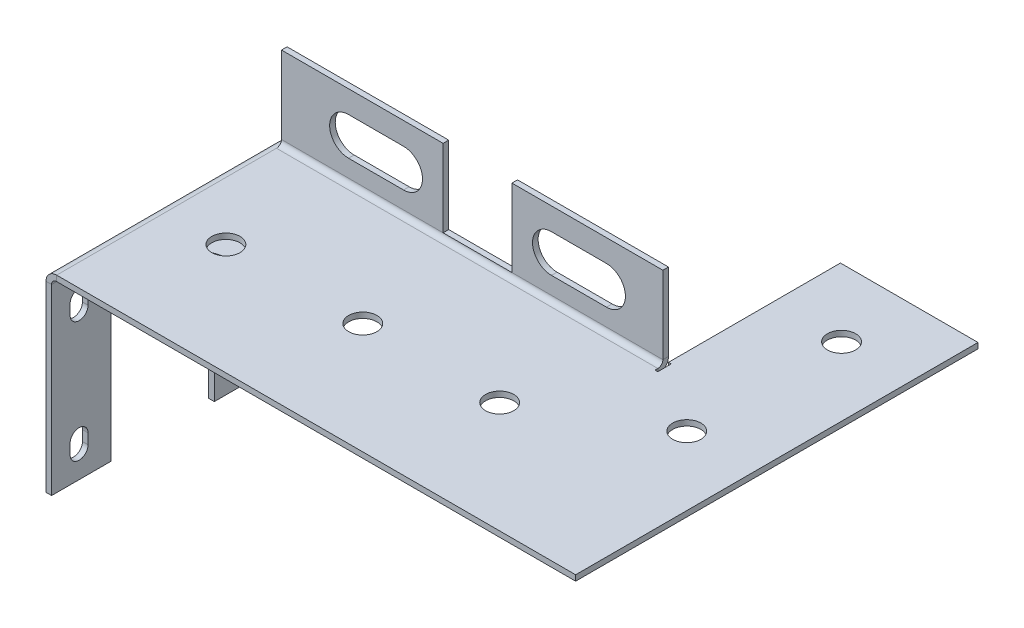
from build123d import *

# Parameters (mm, degrees)
BASE_FLANGE2_DEPTH           = 0.8128
EDGE_FLANGE1_STRIP_W         = 4.7244
EDGE_FLANGE1_STRIP_H         = 0.8128
EDGE_FLANGE1_STRIP_CUT_DEPTH = 33.5
EDGE_FLANGE1_DEPTH           = 33.5
EDGE_FLANGE1_FLAT_DEPTH      = 0.8128
EDGE_FLANGE3_START           = 0.7366
EDGE_FLANGE3_DEPTH           = 55.857
EDGE_FLANGE3_START_2         = 56.1872
EDGE_FLANGE3_2_DEPTH         = 0.4064
EDGE_FLANGE3_3_DEPTH         = 55.4506
CUT_EXTRUDE1_REACH           = 93.316
SKETCH21_R                   = 2.05
CUT_EXTRUDE2_REACH           = 88.903
SKETCH22_W                   = 10
SKETCH22_H                   = 11.2634
EDGE_FLANGE4_START           = -7.3164
EDGE_FLANGE4_DEPTH           = 15.8128
EDGE_FLANGE4_2_DEPTH         = 0.4064
EDGE_FLANGE4_START_2         = 8.09
EDGE_FLANGE4_3_DEPTH         = 0.4064
EDGE_FLANGE4_START_3         = -6.91
EDGE_FLANGE4_4_DEPTH         = 15
CUT_EXTRUDE3_REACH           = 91.576
CUT_EXTRUDE4_REACH           = 92.702
CUT_EXTRUDE6_START           = 6.5406
CUT_EXTRUDE6_DEPTH           = 1.5494


# Read off the part's stored shape, not the designer's step: Edge-Flange3, Edge-Flange4, Cut-Extrude6
# Sheet-metal steps are written as plain solids
with BuildPart() as part:
    # Sketch7 → Base-Flange2 (new body)
    with BuildSketch(Plane.YZ):
        Polygon((-14.0628, 8.09), (7.7628, 8.09), (7.7628, -6.91), (-14.0628, -6.91), (-14.0628, -16.75), (14.0628, -16.75), (14.0628, 16.75), (-14.0628, 16.75), align=None)
    extrude(amount=-BASE_FLANGE2_DEPTH)

    # Edge-Flange1 strip (across the edge) → Edge-Flange1 strip cut (cut)
    with BuildSketch(Plane(origin=(0, 14.0628, -16.75), x_dir=(0, -1, 0), z_dir=(0, 0, 1))):
        with Locations((-0.8128, -0.4064)):
            Rectangle(EDGE_FLANGE1_STRIP_W, EDGE_FLANGE1_STRIP_H)
    extrude(amount=EDGE_FLANGE1_STRIP_CUT_DEPTH, mode=Mode.SUBTRACT)

    # Edge-Flange1 bend section (across the edge) → Edge-Flange1 (add)
    with BuildSketch(Plane(origin=(0, 14.0628, -16.75), x_dir=(0, -1, 0), z_dir=(0, 0, 1))):
        with BuildLine():
            Line((0, 0.7366), (0.8128, 0.7366))
            ThreePointArc((0.8128, 0.7366), (1.028545145, 0.215745145), (1.5494, 0))
            Line((1.5494, 0), (1.5494, -0.8128))
            ThreePointArc((1.5494, -0.8128), (0.453808753, -0.358991247), (0, 0.7366))
        make_face()
    extrude(amount=EDGE_FLANGE1_DEPTH)

    # Edge-Flange1 profile (on flange) → Edge-Flange1 flat (add)
    with BuildSketch(Plane.ZX.offset(14.0628)):
        Polygon((-41.75, 56.1872), (-16.75, 56.1872), (-16.75, 0.7366), (16.75, 0.7366), (16.75, 76.1872), (-41.75, 76.1872), align=None)
    extrude(amount=-EDGE_FLANGE1_FLAT_DEPTH)

    # Edge-Flange3 outline → Edge-Flange3 (cut)
    with BuildSketch(Plane.YZ.offset(EDGE_FLANGE3_START)):
        with BuildLine():
            Line((14.0628, -16.75), (14.0628, -16.563707039))
            ThreePointArc((14.0628, -16.563707039), (13.468624211, -15.994121367), (13.25, -15.2006))
            Line((13.25, -15.2006), (13.25, -16.75))
            Line((13.25, -16.75), (14.0628, -16.75))
        make_face()
    extrude(amount=EDGE_FLANGE3_DEPTH, mode=Mode.SUBTRACT)

    # Edge-Flange3 2 outline → Edge-Flange3 2 (cut)
    with BuildSketch(Plane.YZ.offset(EDGE_FLANGE3_START_2)):
        with BuildLine():
            ThreePointArc((13.25, -15.2006), (13.468624211, -15.994121367), (14.0628, -16.563707039))
            Line((14.0628, -16.563707039), (14.0628, -14.7942))
            Line((14.0628, -14.7942), (13.25, -14.7942))
            Line((13.25, -14.7942), (13.25, -15.2006))
        make_face()
    extrude(amount=EDGE_FLANGE3_2_DEPTH, mode=Mode.SUBTRACT)

    # Edge-Flange3 3 outline → Edge-Flange3 3 (add)
    with BuildSketch(Plane.YZ.offset(EDGE_FLANGE3_START)):
        with BuildLine():
            Line((14.7994, -16.75), (26.0628, -16.75))
            Line((26.0628, -16.75), (26.0628, -15.9372))
            Line((26.0628, -15.9372), (14.7994, -15.9372))
            ThreePointArc((14.7994, -15.9372), (14.278545145, -15.721454855), (14.0628, -15.2006))
            Line((14.0628, -15.2006), (14.0628, -16.563707039))
            ThreePointArc((14.0628, -16.563707039), (14.419503755, -16.702704924), (14.7994, -16.75))
        make_face()
    extrude(amount=EDGE_FLANGE3_3_DEPTH)

    # Sketch21 → Cut-Extrude1 (cut, up to next)
    with BuildSketch(Plane(origin=(0, 14.0628, 0), x_dir=(-1, 0, 0), z_dir=(0, 1, 0)), mode=Mode.PRIVATE) as cut_extrude1_sk1:
        with Locations((-66.1872, -31.91)):
            Circle(SKETCH21_R)
    cut_extrude1_tool1 = extrude(cut_extrude1_sk1.sketch, amount=-CUT_EXTRUDE1_REACH, mode=Mode.PRIVATE) & part.part
    # Sketch21 → Cut-Extrude1 (cut, up to next)
    with BuildSketch(Plane(origin=(0, 14.0628, 0), x_dir=(-1, 0, 0), z_dir=(0, 1, 0)), mode=Mode.PRIVATE) as cut_extrude1_sk2:
        with Locations((-66.1872, -9.41)):
            Circle(SKETCH21_R)
    cut_extrude1_tool2 = extrude(cut_extrude1_sk2.sketch, amount=-CUT_EXTRUDE1_REACH, mode=Mode.PRIVATE) & part.part
    # Sketch21 → Cut-Extrude1 (cut, up to next)
    with BuildSketch(Plane(origin=(0, 14.0628, 0), x_dir=(-1, 0, 0), z_dir=(0, 1, 0)), mode=Mode.PRIVATE) as cut_extrude1_sk3:
        with Locations((-48.982258849, 0.59)):
            Circle(SKETCH21_R)
    cut_extrude1_tool3 = extrude(cut_extrude1_sk3.sketch, amount=-CUT_EXTRUDE1_REACH, mode=Mode.PRIVATE) & part.part
    # Sketch21 → Cut-Extrude1 (cut, up to next)
    with BuildSketch(Plane(origin=(0, 14.0628, 0), x_dir=(-1, 0, 0), z_dir=(0, 1, 0)), mode=Mode.PRIVATE) as cut_extrude1_sk4:
        with Locations((-29.082258849, 0.59)):
            Circle(SKETCH21_R)
    cut_extrude1_tool4 = extrude(cut_extrude1_sk4.sketch, amount=-CUT_EXTRUDE1_REACH, mode=Mode.PRIVATE) & part.part
    # Sketch21 → Cut-Extrude1 (cut, up to next)
    with BuildSketch(Plane(origin=(0, 14.0628, 0), x_dir=(-1, 0, 0), z_dir=(0, 1, 0)), mode=Mode.PRIVATE) as cut_extrude1_sk5:
        with Locations((-9.182258849, 0.59)):
            Circle(SKETCH21_R)
    cut_extrude1_tool5 = extrude(cut_extrude1_sk5.sketch, amount=-CUT_EXTRUDE1_REACH, mode=Mode.PRIVATE) & part.part
    add(cut_extrude1_tool1.solids().sort_by_distance((66.1872, 14.0628, -31.91))[0], mode=Mode.SUBTRACT)
    add(cut_extrude1_tool2.solids().sort_by_distance((66.1872, 14.0628, -9.41))[0], mode=Mode.SUBTRACT)
    add(cut_extrude1_tool3.solids().sort_by_distance((48.982259, 14.0628, 0.59))[0], mode=Mode.SUBTRACT)
    add(cut_extrude1_tool4.solids().sort_by_distance((29.082259, 14.0628, 0.59))[0], mode=Mode.SUBTRACT)
    add(cut_extrude1_tool5.solids().sort_by_distance((9.182259, 14.0628, 0.59))[0], mode=Mode.SUBTRACT)

    # Sketch22 → Cut-Extrude2 (cut, up to next)
    with BuildSketch(Plane.XY.offset(-15.9372), mode=Mode.PRIVATE) as cut_extrude2_sk1:
        with BuildLine():
            Line((10.4866, 22.8128), (18.4866, 22.8128))
            ThreePointArc((18.4866, 22.8128), (21.2366, 20.0628), (18.4866, 17.3128))
            Line((18.4866, 17.3128), (10.4866, 17.3128))
            ThreePointArc((10.4866, 17.3128), (7.7366, 20.0628), (10.4866, 22.8128))
        make_face()
    cut_extrude2_tool1 = extrude(cut_extrude2_sk1.sketch, amount=-CUT_EXTRUDE2_REACH, mode=Mode.PRIVATE) & part.part
    # Sketch22 → Cut-Extrude2 (cut, up to next)
    with BuildSketch(Plane.XY.offset(-15.9372), mode=Mode.PRIVATE) as cut_extrude2_sk2:
        with BuildLine():
            Line((47.9866, 22.8128), (39.9866, 22.8128))
            ThreePointArc((39.9866, 22.8128), (37.2366, 20.0628), (39.9866, 17.3128))
            Line((39.9866, 17.3128), (47.9866, 17.3128))
            ThreePointArc((47.9866, 17.3128), (50.7366, 20.0628), (47.9866, 22.8128))
        make_face()
    cut_extrude2_tool2 = extrude(cut_extrude2_sk2.sketch, amount=-CUT_EXTRUDE2_REACH, mode=Mode.PRIVATE) & part.part
    # Sketch22 → Cut-Extrude2 (cut, up to next)
    with BuildSketch(Plane.XY.offset(-15.9372), mode=Mode.PRIVATE) as cut_extrude2_sk3:
        with Locations((29.2366, 20.4311)):
            Rectangle(SKETCH22_W, SKETCH22_H)
    cut_extrude2_tool3 = extrude(cut_extrude2_sk3.sketch, amount=-CUT_EXTRUDE2_REACH, mode=Mode.PRIVATE) & part.part
    add(cut_extrude2_tool1.solids().sort_by_distance((14.4866, 20.0628, -15.9372))[0], mode=Mode.SUBTRACT)
    add(cut_extrude2_tool2.solids().sort_by_distance((43.9866, 20.0628, -15.9372))[0], mode=Mode.SUBTRACT)
    add(cut_extrude2_tool3.solids().sort_by_distance((29.2366, 20.4311, -15.9372))[0], mode=Mode.SUBTRACT)

    # Edge-Flange4 outline → Edge-Flange4 (cut)
    with BuildSketch(Plane.XY.offset(EDGE_FLANGE4_START)):
        with BuildLine():
            ThreePointArc((0, 7.949092961), (-0.594175789, 8.518678633), (-0.8128, 9.3122))
            Line((-0.8128, 9.3122), (-0.8128, 7.7628))
            Line((-0.8128, 7.7628), (0, 7.7628))
            Line((0, 7.7628), (0, 7.949092961))
        make_face()
    extrude(amount=EDGE_FLANGE4_DEPTH, mode=Mode.SUBTRACT)

    # Edge-Flange4 2 outline → Edge-Flange4 2 (cut)
    with BuildSketch(Plane.XY.offset(EDGE_FLANGE4_START)):
        with BuildLine():
            Line((0, 9.7186), (-0.8128, 9.7186))
            Line((-0.8128, 9.7186), (-0.8128, 9.3122))
            ThreePointArc((-0.8128, 9.3122), (-0.594175789, 8.518678633), (0, 7.949092961))
            Line((0, 7.949092961), (0, 9.7186))
        make_face()
    extrude(amount=EDGE_FLANGE4_2_DEPTH, mode=Mode.SUBTRACT)

    # Edge-Flange4 3 outline → Edge-Flange4 3 (cut)
    with BuildSketch(Plane.XY.offset(EDGE_FLANGE4_START_2)):
        with BuildLine():
            Line((0, 9.7186), (-0.8128, 9.7186))
            Line((-0.8128, 9.7186), (-0.8128, 9.3122))
            ThreePointArc((-0.8128, 9.3122), (-0.594175789, 8.518678633), (0, 7.949092961))
            Line((0, 7.949092961), (0, 9.7186))
        make_face()
    extrude(amount=EDGE_FLANGE4_3_DEPTH, mode=Mode.SUBTRACT)

    # Edge-Flange4 4 outline → Edge-Flange4 4 (add)
    with BuildSketch(Plane.XY.offset(EDGE_FLANGE4_START_3)):
        with BuildLine():
            ThreePointArc((0.7366, 8.5756), (0.215745145, 8.791345145), (0, 9.3122))
            Line((0, 9.3122), (0, 7.949092961))
            ThreePointArc((0, 7.949092961), (0.356703755, 7.810095076), (0.7366, 7.7628))
            Line((0.7366, 7.7628), (16.1872, 7.7628))
            Line((16.1872, 7.7628), (16.1872, 8.5756))
            Line((16.1872, 8.5756), (0.7366, 8.5756))
        make_face()
    extrude(amount=EDGE_FLANGE4_4_DEPTH)

    # Sketch27 → Cut-Extrude3 (cut, up to next)
    with BuildSketch(Plane.XZ.offset(-7.7628), mode=Mode.PRIVATE) as cut_extrude3_sk1:
        with BuildLine():
            Line((9.732258849, -3.21), (5.332258849, -3.21))
            ThreePointArc((5.332258849, -3.21), (1.532258849, 0.59), (5.332258849, 4.39))
            Line((5.332258849, 4.39), (9.732258849, 4.39))
            ThreePointArc((9.732258849, 4.39), (13.532258849, 0.59), (9.732258849, -3.21))
        make_face()
    cut_extrude3_tool1 = extrude(cut_extrude3_sk1.sketch, amount=-CUT_EXTRUDE3_REACH, mode=Mode.PRIVATE) & part.part
    add(cut_extrude3_tool1.solids().sort_by_distance((7.532259, 7.7628, 0.59))[0], mode=Mode.SUBTRACT)

    # Sketch33 → Cut-Extrude4 (cut, up to next)
    with BuildSketch(Plane.YZ, mode=Mode.PRIVATE) as cut_extrude4_sk1:
        with BuildLine():
            Line((-10.3128, -13.75), (-8.8128, -13.75))
            ThreePointArc((-8.8128, -13.75), (-7.5128, -12.45), (-8.8128, -11.15))
            Line((-8.8128, -11.15), (-10.3128, -11.15))
            ThreePointArc((-10.3128, -11.15), (-11.6128, -12.45), (-10.3128, -13.75))
        make_face()
    cut_extrude4_tool1 = extrude(cut_extrude4_sk1.sketch, amount=-CUT_EXTRUDE4_REACH, mode=Mode.PRIVATE) & part.part
    # Sketch33 → Cut-Extrude4 (cut, up to next)
    with BuildSketch(Plane.YZ, mode=Mode.PRIVATE) as cut_extrude4_sk2:
        with BuildLine():
            Line((7.2634, -13.75), (8.7634, -13.75))
            ThreePointArc((8.7634, -13.75), (10.0634, -12.45), (8.7634, -11.15))
            Line((8.7634, -11.15), (7.2634, -11.15))
            ThreePointArc((7.2634, -11.15), (5.9634, -12.45), (7.2634, -13.75))
        make_face()
    cut_extrude4_tool2 = extrude(cut_extrude4_sk2.sketch, amount=-CUT_EXTRUDE4_REACH, mode=Mode.PRIVATE) & part.part
    # Sketch33 → Cut-Extrude4 (cut, up to next)
    with BuildSketch(Plane.YZ, mode=Mode.PRIVATE) as cut_extrude4_sk3:
        with BuildLine():
            Line((-10.3128, 11.45), (-8.8128, 11.45))
            ThreePointArc((-8.8128, 11.45), (-7.5128, 12.75), (-8.8128, 14.05))
            Line((-8.8128, 14.05), (-10.3128, 14.05))
            ThreePointArc((-10.3128, 14.05), (-11.6128, 12.75), (-10.3128, 11.45))
        make_face()
    cut_extrude4_tool3 = extrude(cut_extrude4_sk3.sketch, amount=-CUT_EXTRUDE4_REACH, mode=Mode.PRIVATE) & part.part
    # Sketch33 → Cut-Extrude4 (cut, up to next)
    with BuildSketch(Plane.YZ, mode=Mode.PRIVATE) as cut_extrude4_sk4:
        with BuildLine():
            Line((7.2634, 11.45), (8.7634, 11.45))
            ThreePointArc((8.7634, 11.45), (10.0634, 12.75), (8.7634, 14.05))
            Line((8.7634, 14.05), (7.2634, 14.05))
            ThreePointArc((7.2634, 14.05), (5.9634, 12.75), (7.2634, 11.45))
        make_face()
    cut_extrude4_tool4 = extrude(cut_extrude4_sk4.sketch, amount=-CUT_EXTRUDE4_REACH, mode=Mode.PRIVATE) & part.part
    add(cut_extrude4_tool1.solids().sort_by_distance((0, -9.5628, -12.45))[0], mode=Mode.SUBTRACT)
    add(cut_extrude4_tool2.solids().sort_by_distance((0, 8.0134, -12.45))[0], mode=Mode.SUBTRACT)
    add(cut_extrude4_tool3.solids().sort_by_distance((0, -9.5628, 12.75))[0], mode=Mode.SUBTRACT)
    add(cut_extrude4_tool4.solids().sort_by_distance((0, 8.0134, 12.75))[0], mode=Mode.SUBTRACT)

    # Cut-Extrude6 outline → Cut-Extrude6 (cut)
    with BuildSketch(Plane.XY.offset(CUT_EXTRUDE6_START)):
        with BuildLine():
            ThreePointArc((-0.712123576, 8.7628), (-0.143570438, 8.037076335), (0.7366, 7.7628))
            Line((0.7366, 7.7628), (0.7366, 8.5756))
            ThreePointArc((0.7366, 8.5756), (0.318158316, 8.705993668), (0.047862562, 9.051009836))
            Line((0.047862562, 9.051009836), (-0.712123576, 8.7628))
        make_face()
    cut_extrude6 = extrude(amount=CUT_EXTRUDE6_DEPTH, mode=Mode.SUBTRACT)

    # Mirror1: Cut-Extrude6 across plane
    add(cut_extrude6.mirror(Plane.XY.offset(0.59)), mode=Mode.SUBTRACT)


solid = part.part
